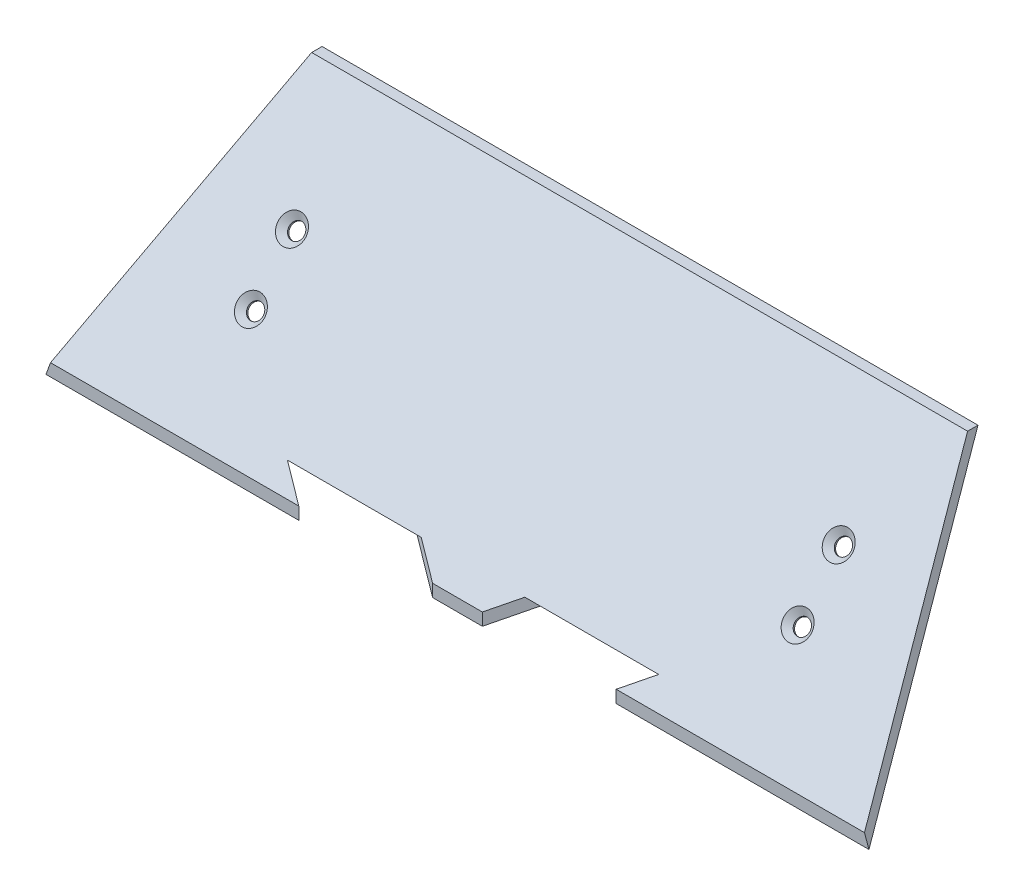
from build123d import *

# Parameters (mm, degrees)
BOSS_EXTRUDE1_DEPTH                             = 186.947944
CUT_EXTRUDE1_DEPTH                              = 202.219677631
CUT_EXTRUDE2_DEPTH                              = 119.891891944
CSK_FOR_M3_FLAT_HEAD_MACHINE_SCREW1_D           = 3.5
CSK_FOR_M3_FLAT_HEAD_MACHINE_SCREW1_DEPTH       = 5
CSK_FOR_M3_FLAT_HEAD_MACHINE_SCREW1_CSINK_D     = 6.3
CSK_FOR_M3_FLAT_HEAD_MACHINE_SCREW1_CSINK_ANGLE = 90
CUT_EXTRUDE3_REACH                              = 142.174
SKETCH7_W                                       = 15.2
SKETCH7_H                                       = 8


with BuildPart() as part:
    # Sketch2 → Boss-Extrude1 (new body)
    with BuildSketch(Plane(origin=(0, 0, 0), x_dir=(0, 0, -1), z_dir=(1, 0, 0))):
        Polygon((0, 0), (-2.3622, 0), (45.480481789, 57.016687901), (47.842681789, 57.016687901), align=None)
    extrude(amount=BOSS_EXTRUDE1_DEPTH)

    # Sketch3 → Cut-Extrude1 (cut, through all)
    with BuildSketch(Plane.ZY):
        Polygon((-4.105707607, 4.89299179), (-4.105707607, 7.708152127), (2.3622, 0), (0, 0), align=None)
    extrude(amount=-CUT_EXTRUDE1_DEPTH, mode=Mode.SUBTRACT)

    # Sketch4 → Cut-Extrude2 (cut, through all)
    with BuildSketch(Plane(origin=(93.496468894, -1.981357522, -4.105707607), x_dir=(-1, 0, 0), z_dir=(0, 0, -1))):
        Polygon((93.496468894, 58.998045423), (74.524995009, 58.998045423), (93.496468894, 6.874349312), align=None)
        Polygon((-93.451475106, 6.874349312), (-93.451475106, 58.998045423), (-74.480001222, 58.998045423), align=None)
    extrude(amount=CUT_EXTRUDE2_DEPTH, mode=Mode.SUBTRACT)

    # CSK for M3 Flat Head Machine Screw1
    with Locations(Plane(origin=(0, 1.163156437, 1.386195863), x_dir=(1, 0, 0), z_dir=(0, 0.6427876096865436, 0.7660444431189746))):
        with Locations((31.377677493, 46.65493708), (31.377677493, 32.145498062)):
            csk_for_m3_flat_head_machine_screw1 = CounterSinkHole(CSK_FOR_M3_FLAT_HEAD_MACHINE_SCREW1_D / 2, CSK_FOR_M3_FLAT_HEAD_MACHINE_SCREW1_CSINK_D / 2, depth=CSK_FOR_M3_FLAT_HEAD_MACHINE_SCREW1_DEPTH, counter_sink_angle=CSK_FOR_M3_FLAT_HEAD_MACHINE_SCREW1_CSINK_ANGLE)

    # Mirror1: CSK for M3 Flat Head Machine Screw1 across plane
    add(csk_for_m3_flat_head_machine_screw1.mirror(Plane(origin=(93.473972, 0, 0), x_dir=(0, 0, 1), z_dir=(1, 0, 0))), mode=Mode.SUBTRACT)

    # Cut-Extrude3: up to this plane
    cut_extrude3_end = Plane(origin=(186.947944, 0, 2.3622), z_dir=(0, -0.6427876096865434, -0.7660444431189748))
    # Sketch7 → Cut-Extrude3 (cut, up to the surface)
    with BuildSketch(Plane(origin=(112.633038957, 0, -65.028715361), x_dir=(0.4999999999999981, -1.9080601945838373e-15, 0.8660254037844397), z_dir=(-0.8660254037844397, 3.3048572009189827e-15, 0.4999999999999981)), mode=Mode.PRIVATE) as cut_extrude3_sk1:
        with Locations((53.60637797, 7.918642478)):
            Rectangle(SKETCH7_W, SKETCH7_H)
    cut_extrude3_tool1 = split(extrude(cut_extrude3_sk1.sketch, amount=CUT_EXTRUDE3_REACH, mode=Mode.PRIVATE), bisect_by=cut_extrude3_end, keep=Keep.BOTH, mode=Mode.PRIVATE)
    cut_extrude3 = cut_extrude3_tool1.solids().sort_by_distance((139.436228, 7.918642, -18.60423))[0]
    add(cut_extrude3, mode=Mode.SUBTRACT)

    # Mirror2: Cut-Extrude3 across plane
    add(cut_extrude3.mirror(Plane(origin=(93.473972, 0, 0), x_dir=(0, 0, 1), z_dir=(1, 0, 0))), mode=Mode.SUBTRACT)


solid = part.part
